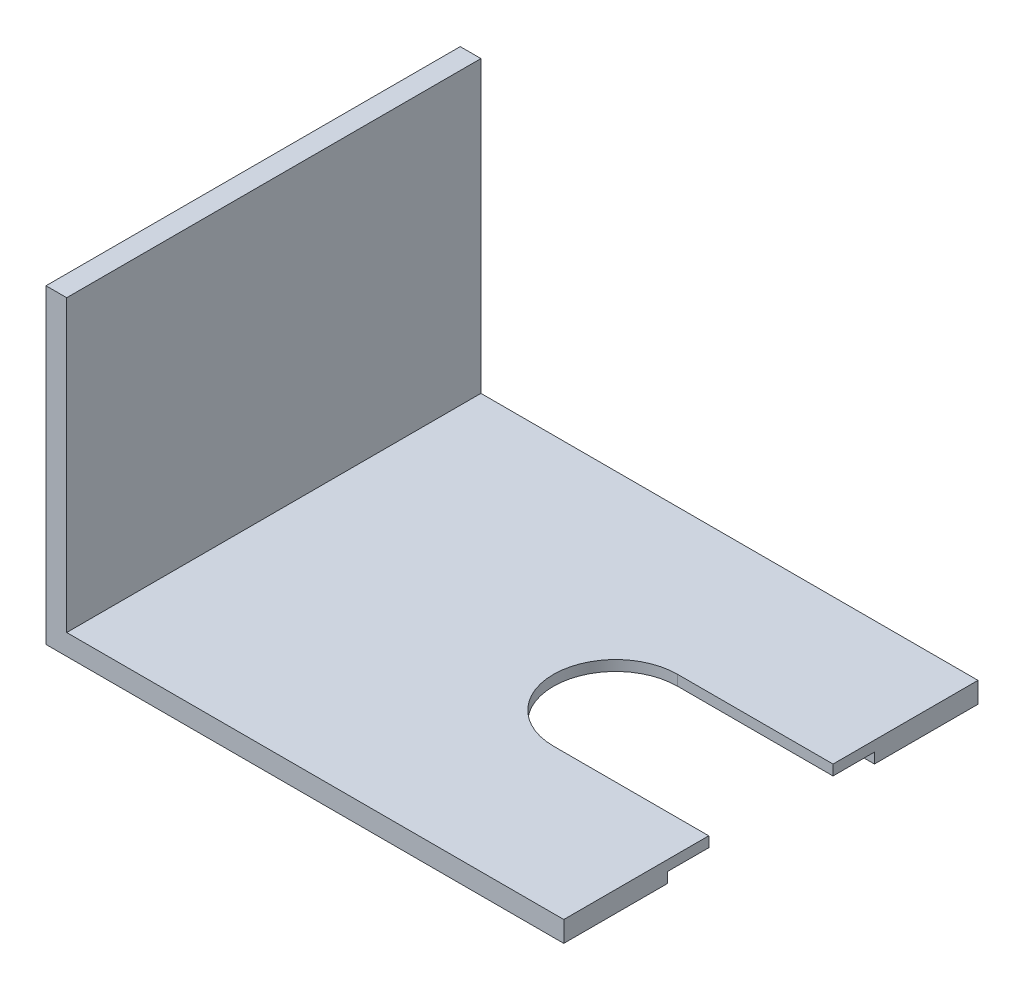
from build123d import *

# Parameters (mm, degrees)
BOSS_EXTRUDE1_DEPTH = 40
CUT_EXTRUDE1_DEPTH  = 71.710678119
CUT_EXTRUDE2_DEPTH  = 1


with BuildPart() as part:
    # Sketch1 → Boss-Extrude1 (new body)
    with BuildSketch(Plane.XY):
        Polygon((0, 0), (0, 30), (2, 30), (2, 2), (50, 2), (50, 0), align=None)
    extrude(amount=BOSS_EXTRUDE1_DEPTH)

    # Sketch4 → Cut-Extrude1 (cut, through all)
    with BuildSketch(Plane(origin=(0, 0, 0), x_dir=(-1, 0, 0), z_dir=(0, -1, 0))):
        with BuildLine():
            Line((-50, -26), (-35, -26))
            ThreePointArc((-35, -26), (-29, -20), (-35, -14))
            Line((-35, -14), (-50, -14))
            Line((-50, -14), (-50, -26))
        make_face()
    extrude(amount=-CUT_EXTRUDE1_DEPTH, mode=Mode.SUBTRACT)

    # Sketch5 → Cut-Extrude2 (cut)
    with BuildSketch(Plane(origin=(0, 0, 0), x_dir=(-1, 0, 0), z_dir=(0, -1, 0))):
        with BuildLine():
            Line((-35, -26), (-50, -26))
            Line((-50, -26), (-50, -30))
            Line((-50, -30), (-35, -30))
            ThreePointArc((-35, -30), (-25.011846765, -20.486615818), (-34.027921329, -10.047358991))
            Line((-34.027921329, -10.047358991), (-50, -10))
            Line((-50, -10), (-50, -14))
            Line((-50, -14), (-35, -14))
            ThreePointArc((-35, -14), (-29, -20), (-35, -26))
        make_face()
    extrude(amount=-CUT_EXTRUDE2_DEPTH, mode=Mode.SUBTRACT)


solid = part.part
